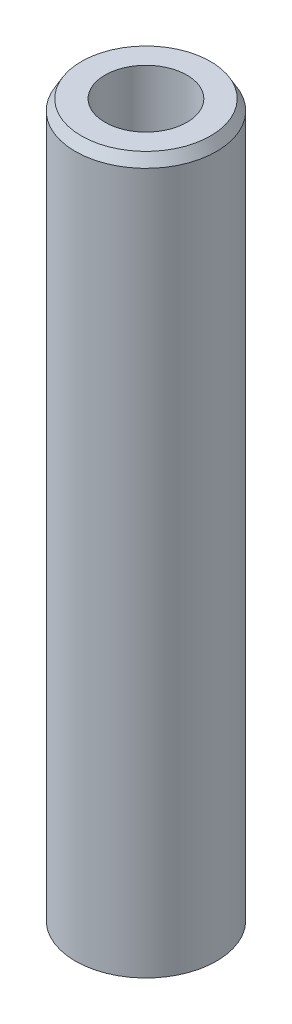
from build123d import *
from OCP.BRepFilletAPI import BRepFilletAPI_MakeChamfer

# Parameters (mm, degrees)
SKETCH1_R           = 22.5
BOSS_EXTRUDE1_DEPTH = 228.81271796
SKETCH2_R           = 13.058179177
CUT_EXTRUDE1_DEPTH  = 232.014631355
CHAMFER1_SIZE       = 3.329369938
CHAMFER1_SIZE2      = 1.92221263


with BuildPart() as part:
    # Sketch1 → Boss-Extrude1 (new body)
    with BuildSketch(Plane(origin=(0, 0, 0), x_dir=(1, 0, 0), z_dir=(0, 1, 0))):
        Circle(SKETCH1_R)
    extrude(amount=BOSS_EXTRUDE1_DEPTH)

    # Sketch2 → Cut-Extrude1 (cut, through all)
    with BuildSketch(Plane(origin=(0, 0, 0), x_dir=(1, 0, 0), z_dir=(0, 1, 0))):
        Circle(SKETCH2_R)
    extrude(amount=CUT_EXTRUDE1_DEPTH, mode=Mode.SUBTRACT)

    # Chamfer1: one chamfer whose edges measure the first distance from different faces: ONE call of the kernel's chamfer builder (chamfer() names one face for all edges)
    chamfer1_edges_1 = [part.edges().sort_by_distance(p)[0] for p in [
        (-22.5, 228.81271796, 0),
    ]]
    chamfer1_side_1 = [part.faces().sort_by_distance(p)[0] for p in [
        (-22.5, 114.40635898, 0),
    ]]
    chamfer1_edges_2 = [part.edges().sort_by_distance(p)[0] for p in [
        (-22.5, 0, 0),
    ]]
    chamfer1_side_2 = [part.faces().sort_by_distance(p)[0] for p in [
        (-21.863603897, 0, 0),
    ]]
    chamfer1 = BRepFilletAPI_MakeChamfer(part.part.solid().wrapped)
    for e in chamfer1_edges_1:
        chamfer1.Add(CHAMFER1_SIZE, CHAMFER1_SIZE2, e.wrapped, chamfer1_side_1[0].wrapped)  # the first distance lies on this face
    for e in chamfer1_edges_2:
        chamfer1.Add(CHAMFER1_SIZE, CHAMFER1_SIZE2, e.wrapped, chamfer1_side_2[0].wrapped)  # the first distance lies on this face
    add(Compound.cast(chamfer1.Shape()), mode=Mode.REPLACE)


solid = part.part
